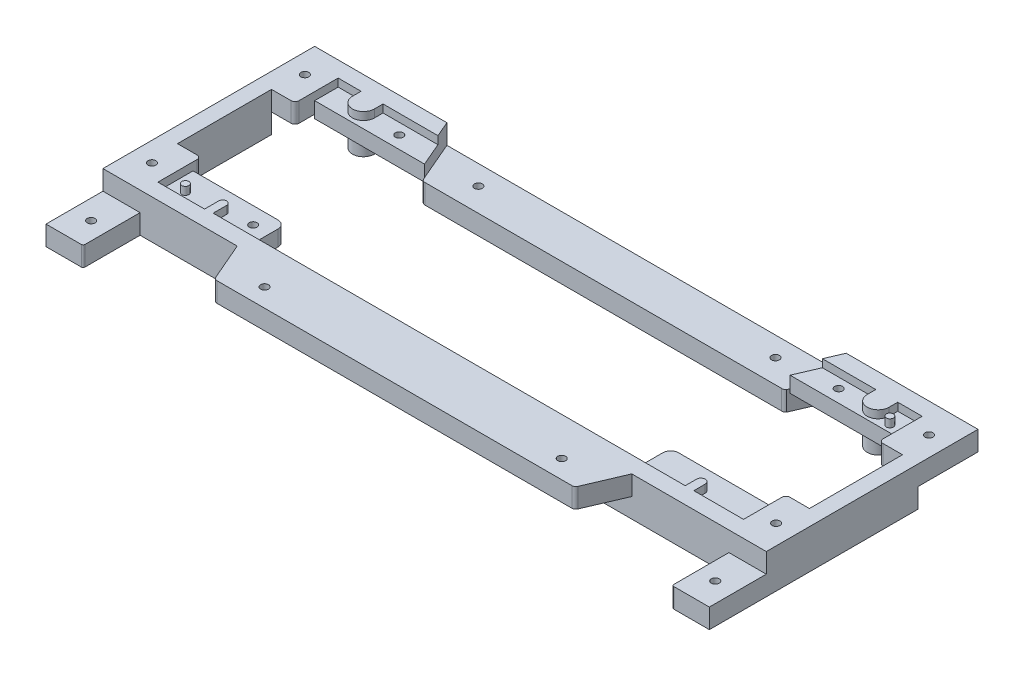
from build123d import *

# Parameters (mm, degrees)
SKETCH1_W                = 84.6
SKETCH1_H                = 27
BOSS_EXTRUDE1_DEPTH      = 5
CUT_EXTRUDE1_REACH       = 50.274
BOSS_EXTRUDE3_START      = 2
BOSS_EXTRUDE3_DEPTH      = 2
CUT_EXTRUDE3_START       = -2.5
CUT_EXTRUDE3_DEPTH       = 2.5
CUT_EXTRUDE5_START       = -2.5
CUT_EXTRUDE5_DEPTH       = 46.773999335
BOSS_EXTRUDE4_DEPTH      = 2.5
BOSS_EXTRUDE5_START      = -2.5
BOSS_EXTRUDE5_DEPTH      = 2.5
CUT_EXTRUDE2_OUTLINE_R   = 0.5
CUT_EXTRUDE2_OUTLINE_R_2 = 0.499999992
CUT_EXTRUDE2_DEPTH       = 5
SKETCH15_R               = 0.5
CUT_EXTRUDE6_DEPTH       = 50.255349811
SKETCH16_R               = 0.45
BOSS_EXTRUDE6_DEPTH      = 1


# Read off the part's stored shape, not the designer's step: Cut-Extrude2
with BuildPart() as part:
    # Sketch1 → Boss-Extrude1 (new body)
    with BuildSketch(Plane(origin=(0, 0, 0), x_dir=(1, 0, 0), z_dir=(0, 1, 0))):
        with Locations((3.06331835, 2.23366963)):
            Rectangle(SKETCH1_W, SKETCH1_H)
    extrude(amount=BOSS_EXTRUDE1_DEPTH)

    # Sketch3 → Cut-Extrude1 (cut, up to next)
    with BuildSketch(Plane(origin=(0, 0, 0), x_dir=(1, 0, 0), z_dir=(0, 1, 0)), mode=Mode.PRIVATE) as cut_extrude1_sk1:
        with BuildLine():
            Line((32.919678843, -9.163538235), (-27.280321157, -9.163538235))
            Line((-27.280321157, -9.163538235), (-27.280321157, -7.45100236))
            ThreePointArc((-27.280321157, -7.45100236), (-27.780321157, -6.95100236), (-28.280321157, -7.45100236))
            Line((-28.280321157, -7.45100236), (-28.280321157, -9.262483826))
            Line((-28.280321157, -9.262483826), (-34.233122665, -9.262483826))
            Line((-34.233122665, -9.262483826), (-34.233122665, -4.266133774))
            ThreePointArc((-34.233122665, -4.266133774), (-34.380628165, -3.910023997), (-34.736737941, -3.762518498))
            Line((-34.736737941, -3.762518498), (-37.233015401, -3.762518498))
            Line((-37.233015401, -3.762518498), (-37.233015401, 8.229171698))
            Line((-37.233015401, 8.229171698), (-34.736926038, 8.23003019))
            ThreePointArc((-34.736926038, 8.23003019), (-34.380928238, 8.377596904), (-34.233483972, 8.733645436))
            Line((-34.233483972, 8.733645436), (-34.233483972, 13.729919004))
            Line((-34.233483972, 13.729919004), (-31.31194803, 13.729919004))
            Line((-31.31194803, 13.729919004), (-31.31194803, 12.633776758))
            ThreePointArc((-31.31194803, 12.633776758), (-29.91194803, 11.233776758), (-28.51194803, 12.633776758))
            Line((-28.51194803, 12.633776758), (-28.51194803, 13.730371923))
            Line((-28.51194803, 13.730371923), (-21.508882253, 13.730371923))
            Line((-21.508882253, 13.730371923), (-20.139800412, 10.535595096))
            ThreePointArc((-20.139800412, 10.535595096), (-19.954180397, 10.31357804), (-19.676997597, 10.230415195))
            Line((-19.676997597, 10.230415195), (25.793967371, 10.230415195))
            ThreePointArc((25.793967371, 10.230415195), (26.055680662, 10.259428791), (26.266864173, 10.416709306))
            Line((26.266864173, 10.416709306), (27.639394616, 13.61080525))
            Line((27.639394616, 13.61080525), (34.4513038, 13.61080525))
            Line((34.4513038, 13.61080525), (34.4513038, 12.512891353))
            ThreePointArc((34.4513038, 12.512891353), (35.8513038, 11.112891353), (37.2513038, 12.512891353))
            Line((37.2513038, 12.512891353), (37.2513038, 13.612023992))
            Line((37.2513038, 13.612023992), (40.361611802, 13.612023992))
            Line((40.361611802, 13.612023992), (40.361611802, 8.61576965))
            ThreePointArc((40.361611802, 8.61576965), (40.509053891, 8.259723294), (40.865047712, 8.112154406))
            Line((40.865047712, 8.112154406), (43.361137065, 8.111265408))
            Line((43.361137065, 8.111265408), (43.361137065, -3.763055079))
            Line((43.361137065, -3.763055079), (40.86393165, -3.763055079))
            ThreePointArc((40.86393165, -3.763055079), (40.507821873, -3.910560578), (40.360316374, -4.266670355))
            Line((40.360316374, -4.266670355), (40.360316374, -9.163538235))
            Line((40.360316374, -9.163538235), (34.019678843, -9.163538235))
            Line((34.019678843, -9.163538235), (34.019678843, -7.715606668))
            ThreePointArc((34.019678843, -7.715606668), (33.469678843, -7.165606668), (32.919678843, -7.715606668))
            Line((32.919678843, -7.715606668), (32.919678843, -9.163538235))
        make_face()
    cut_extrude1_tool1 = extrude(cut_extrude1_sk1.sketch, amount=CUT_EXTRUDE1_REACH, mode=Mode.PRIVATE) & part.part
    add(cut_extrude1_tool1.solids().sort_by_distance((3.012517, 0, -1.196465))[0], mode=Mode.SUBTRACT)

    # Sketch3<5> → Boss-Extrude3 (add)
    with BuildSketch(Plane(origin=(0, 0, 0), x_dir=(1, 0, 0), z_dir=(0, 1, 0)).offset(BOSS_EXTRUDE3_START)):
        with BuildLine():
            Line((26.852330657, -9.163538235), (32.919678843, -9.163538235))
            Line((32.919678843, -9.163538235), (32.919678843, -7.715606668))
            ThreePointArc((32.919678843, -7.715606668), (33.469678843, -7.165606668), (34.019678843, -7.715606668))
            Line((34.019678843, -7.715606668), (34.019678843, -9.163538235))
            Line((34.019678843, -9.163538235), (40.360316374, -9.163538235))
            Line((40.360316374, -9.163538235), (40.360316374, -4.950942773))
            Line((40.360316374, -4.950942773), (27.852330657, -4.950942773))
            ThreePointArc((27.852330657, -4.950942773), (27.145223876, -5.243835992), (26.852330657, -5.950942773))
            Line((26.852330657, -5.950942773), (26.852330657, -9.163538235))
        make_face()
        with BuildLine():
            Line((-27.280321157, -9.163538235), (-22.401406955, -9.163538235))
            Line((-22.401406955, -9.163538235), (-22.401406955, -5.777559213))
            ThreePointArc((-22.401406955, -5.777559213), (-22.692236098, -5.07252255), (-23.395560348, -4.777576304))
            Line((-23.395560348, -4.777576304), (-34.233122665, -4.777576304))
            Line((-34.233122665, -4.777576304), (-34.233122665, -9.262483826))
            Line((-34.233122665, -9.262483826), (-28.280321157, -9.262483826))
            Line((-28.280321157, -9.262483826), (-28.280321157, -7.45100236))
            ThreePointArc((-28.280321157, -7.45100236), (-27.780321157, -6.95100236), (-27.280321157, -7.45100236))
            Line((-27.280321157, -7.45100236), (-27.280321157, -9.163538235))
        make_face()
        with BuildLine():
            Line((26.400356299, 10.727366647), (40.361611802, 10.727366647))
            Line((40.361611802, 10.727366647), (40.361611802, 13.612023992))
            Line((40.361611802, 13.612023992), (37.2513038, 13.612023992))
            Line((37.2513038, 13.612023992), (37.2513038, 12.512891353))
            ThreePointArc((37.2513038, 12.512891353), (35.8513038, 11.112891353), (34.4513038, 12.512891353))
            Line((34.4513038, 12.512891353), (34.4513038, 13.61080525))
            Line((34.4513038, 13.61080525), (27.639394616, 13.61080525))
            Line((27.639394616, 13.61080525), (26.400356299, 10.727366647))
        make_face()
        with BuildLine():
            Line((-34.233483972, 13.729919004), (-34.233483972, 10.733923481))
            Line((-34.233483972, 10.733923481), (-20.224791573, 10.733923481))
            Line((-20.224791573, 10.733923481), (-21.508882253, 13.730371923))
            Line((-21.508882253, 13.730371923), (-28.51194803, 13.730371923))
            Line((-28.51194803, 13.730371923), (-28.51194803, 12.633776758))
            ThreePointArc((-28.51194803, 12.633776758), (-29.91194803, 11.233776758), (-31.31194803, 12.633776758))
            Line((-31.31194803, 12.633776758), (-31.31194803, 13.729919004))
            Line((-31.31194803, 13.729919004), (-34.233483972, 13.729919004))
        make_face()
    extrude(amount=BOSS_EXTRUDE3_DEPTH)

    # Sketch13 → Cut-Extrude3 (cut)
    with BuildSketch(Plane(origin=(0, 5, 0), x_dir=(1, 0, 0), z_dir=(0, 1, 0)).offset(CUT_EXTRUDE3_START)):
        with BuildLine():
            Line((-22.367370549, 15.73366963), (-20.139800412, 10.535595096))
            ThreePointArc((-20.139800412, 10.535595096), (-19.954180397, 10.31357804), (-19.676997597, 10.230415195))
            Line((-19.676997597, 10.230415195), (25.793967371, 10.230415195))
            ThreePointArc((25.793967371, 10.230415195), (26.055680662, 10.259428791), (26.266864173, 10.416709306))
            Line((26.266864173, 10.416709306), (28.551607662, 15.73366963))
            Line((28.551607662, 15.73366963), (-22.367370549, 15.73366963))
        make_face()
    extrude(amount=CUT_EXTRUDE3_DEPTH, mode=Mode.SUBTRACT)

    # Sketch13<4> → Cut-Extrude5 (cut, through all)
    with BuildSketch(Plane(origin=(0, 5, 0), x_dir=(1, 0, 0), z_dir=(0, 1, 0)).offset(CUT_EXTRUDE5_START)):
        with BuildLine():
            Line((-34.233483972, 8.733645436), (-34.233483972, 15.73366963))
            Line((-34.233483972, 15.73366963), (-39.23668165, 15.73366963))
            Line((-39.23668165, 15.73366963), (-39.23668165, 8.228482568))
            Line((-39.23668165, 8.228482568), (-34.736926038, 8.23003019))
            ThreePointArc((-34.736926038, 8.23003019), (-34.380928238, 8.377596904), (-34.233483972, 8.733645436))
        make_face()
        with BuildLine():
            Line((45.36331835, 8.110552318), (45.36331835, 15.73366963))
            Line((45.36331835, 15.73366963), (40.361611802, 15.73366963))
            Line((40.361611802, 15.73366963), (40.361611802, 8.61576965))
            ThreePointArc((40.361611802, 8.61576965), (40.509053891, 8.259723294), (40.865047712, 8.112154406))
            Line((40.865047712, 8.112154406), (45.36331835, 8.110552318))
        make_face()
    extrude(amount=-CUT_EXTRUDE5_DEPTH, mode=Mode.SUBTRACT)

    # Sketch13<7> → Boss-Extrude4 (add)
    with BuildSketch(Plane(origin=(0, 5, 0), x_dir=(1, 0, 0), z_dir=(0, 1, 0))):
        with BuildLine():
            Line((26.149886209, -16.077855955), (28.210353336, -11.26633037))
            Line((28.210353336, -11.26633037), (-22.112103374, -11.26633037))
            Line((-22.112103374, -11.26633037), (-20.033790882, -16.079245346))
            ThreePointArc((-20.033790882, -16.079245346), (-19.849433129, -16.298824073), (-19.574759994, -16.381026671))
            Line((-19.574759994, -16.381026671), (25.690257845, -16.381026671))
            ThreePointArc((25.690257845, -16.381026671), (25.965562547, -16.298408177), (26.149886209, -16.077855955))
        make_face()
    extrude(amount=-BOSS_EXTRUDE4_DEPTH)

    # Sketch13<8> → Boss-Extrude5 (add)
    with BuildSketch(Plane(origin=(0, 5, 0), x_dir=(1, 0, 0), z_dir=(0, 1, 0)).offset(BOSS_EXTRUDE5_START)):
        with BuildLine():
            Line((-34.498583653, -18.273630424), (-34.498583653, -11.26633037))
            Line((-34.498583653, -11.26633037), (-39.23668165, -11.26633037))
            Line((-39.23668165, -11.26633037), (-39.23668165, -18.526779589))
            Line((-39.23668165, -18.526779589), (-34.736829858, -18.526779589))
            ThreePointArc((-34.736829858, -18.526779589), (-34.567511978, -18.447444803), (-34.498583653, -18.273630424))
        make_face()
        with BuildLine():
            Line((45.36331835, -11.26633037), (40.594578125, -11.26633037))
            Line((40.594578125, -11.26633037), (40.594578125, -18.273630424))
            ThreePointArc((40.594578125, -18.273630424), (40.674379022, -18.458317374), (40.863562472, -18.526779589))
            Line((40.863562472, -18.526779589), (45.36331835, -18.526779589))
            Line((45.36331835, -18.526779589), (45.36331835, -11.26633037))
        make_face()
    extrude(amount=-BOSS_EXTRUDE5_DEPTH)

    # Cut-Extrude2 outline → Cut-Extrude2 (cut)
    with BuildSketch(Plane.XZ.offset(-5)):
        with Locations((30.98643714, -12.338409577)):
            Circle(CUT_EXTRUDE2_OUTLINE_R)
        with Locations((-25.04708137, -12.338409577)):
            Circle(CUT_EXTRUDE2_OUTLINE_R)
        with Locations((-24.430322115, 6.911590423)):
            Circle(CUT_EXTRUDE2_OUTLINE_R)
        with Locations((-36.73668165, -11.98366963)):
            Circle(CUT_EXTRUDE2_OUTLINE_R)
        with Locations((-15.856255457, -13.23366963)):
            Circle(CUT_EXTRUDE2_OUTLINE_R)
        with Locations((22.035256025, -13.23366963)):
            Circle(CUT_EXTRUDE2_OUTLINE_R_2)
        with Locations((42.86331835, -11.98366963)):
            Circle(CUT_EXTRUDE2_OUTLINE_R)
        with Locations((-36.73668165, 7.51633037)):
            Circle(CUT_EXTRUDE2_OUTLINE_R)
        with Locations((42.86331835, 7.51633037)):
            Circle(CUT_EXTRUDE2_OUTLINE_R)
    extrude(amount=CUT_EXTRUDE2_DEPTH, mode=Mode.SUBTRACT)

    # Sketch15 → Cut-Extrude6 (cut, through all)
    with BuildSketch(Plane(origin=(0, 5, 0), x_dir=(1, 0, 0), z_dir=(0, 1, 0))):
        with Locations(Location((-15.856255457, -14.031026671, 0), (0, 0, 270))):
            Circle(SKETCH15_R)
        with Locations(Location((22.039147194, -14.031026671, 0), (0, 0, 270))):
            Circle(SKETCH15_R)
        with Locations(Location((-36.73668165, -15.276779589, 0), (0, 0, 270))):
            Circle(SKETCH15_R)
        with Locations(Location((42.86331835, -15.276779589, 0), (0, 0, 270))):
            Circle(SKETCH15_R)
    extrude(amount=-CUT_EXTRUDE6_DEPTH, mode=Mode.SUBTRACT)

    # Sketch16 → Boss-Extrude6 (add)
    with BuildSketch(Plane(origin=(0, 4, 0), x_dir=(1, 0, 0), z_dir=(0, 1, 0))):
        with Locations(Location((38.269677885, 11.588409577, 0), (0, 0, 90))):
            Circle(SKETCH16_R)
        with Locations(Location((-32.330322115, -7.661590423, 0), (0, 0, 90))):
            Circle(SKETCH16_R)
    extrude(amount=BOSS_EXTRUDE6_DEPTH)


solid = part.part
